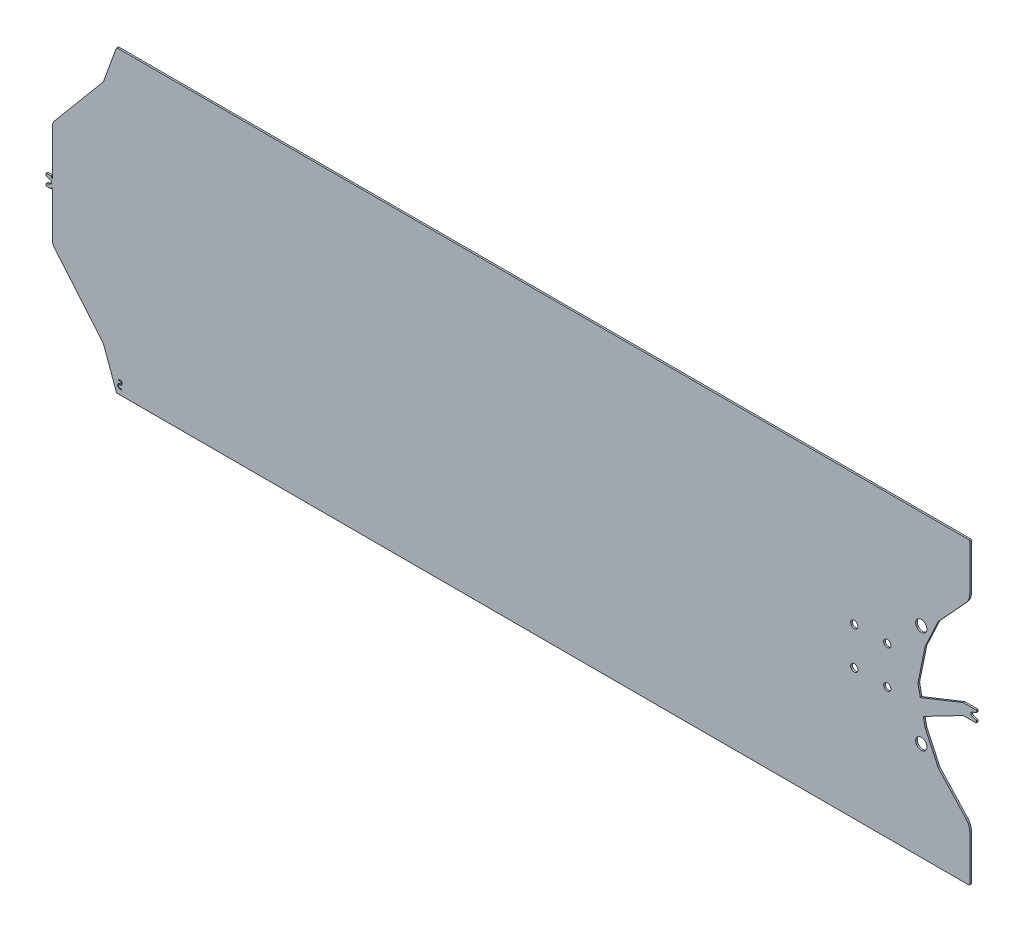
from build123d import *

# Parameters (mm, degrees)
SKETCH1_R                      = 17.125
SKETCH1_R_2                    = 11
BASE_EXTRUDE_DEPTH             = 5
SK_RET_5_TAL_DEPTH             = 2837.452108268
SKETCH2_OUTSIDE_W              = 3414.424
SKETCH2_OUTSIDE_H              = 1500.924
BORTSK_RING_AF_BUKKESTOP_DEPTH = 5
BUKKESTOP_FARINA_DEPTH         = 5


with BuildPart() as part:
    # Sketch1 → Base-Extrude (new body)
    with BuildSketch(Plane.XY):
        with BuildLine():
            Line((0, 450.25), (0, 311.805149274))
            ThreePointArc((0, 311.805149274), (-2.719685229, 297.307627743), (-10.508906528, 284.781540969))
            Line((-10.508906528, 284.781540969), (-94.490164622, 193.132080081))
            ThreePointArc((-94.490164622, 193.132080081), (-95.432087377, 191.931880335), (-96.180469124, 190.602360622))
            Line((-96.180469124, 190.602360622), (-134.781265361, 107.822685955))
            ThreePointArc((-134.781265361, 107.822685955), (-135.215178753, 106.728141402), (-135.517434537, 105.590182681))
            Line((-135.517434537, 105.590182681), (-154.559858359, 11.993679344))
            ThreePointArc((-154.559858359, 11.993679344), (-152.504537753, 3.672946714), (-144.760611313, 0))
            Line((-144.760611313, 0), (17, 0))
            ThreePointArc((17, 0), (19.121320344, -0.878679656), (20, -3))
            Line((20, -3), (20, -17.334351162))
            ThreePointArc((20, -17.334351162), (19.242605724, -19.327017609), (17.352853621, -20.313527948))
            Line((17.352853621, -20.313527948), (-148.861908023, -40))
            Line((-148.861908023, -40), (-135.517434537, -105.590182681))
            ThreePointArc((-135.517434537, -105.590182681), (-135.215178753, -106.728141402), (-134.781265361, -107.822685955))
            Line((-134.781265361, -107.822685955), (-96.180469124, -190.602360622))
            ThreePointArc((-96.180469124, -190.602360622), (-95.432087377, -191.931880335), (-94.490164622, -193.132080081))
            Line((-94.490164622, -193.132080081), (-10.508906528, -284.781540969))
            ThreePointArc((-10.508906528, -284.781540969), (-2.719685229, -297.307627743), (0, -311.805149274))
            Line((0, -311.805149274), (0, -450.25))
            ThreePointArc((0, -450.25), (-0.878679656, -452.371320344), (-3, -453.25))
            Line((-3, -453.25), (-2584.097644203, -453.25))
            ThreePointArc((-2584.097644203, -453.25), (-2585.818373512, -452.707456133), (-2586.916722065, -451.27606043))
            Line((-2586.916722065, -451.27606043), (-2625.631918795, -344.906931626))
            ThreePointArc((-2625.631918795, -344.906931626), (-2626.368590965, -343.327133059), (-2627.368400571, -341.899256963))
            Line((-2627.368400571, -341.899256963), (-2775.320888862, -165.576347508))
            ThreePointArc((-2775.320888862, -165.576347508), (-2778.793852416, -159.560998181), (-2780, -152.720595315))
            Line((-2780, -152.720595315), (-2780, -22.342329219))
            ThreePointArc((-2780, -22.342329219), (-2780.635383686, -20.496092591), (-2782.272393125, -19.431901719))
            Line((-2782.272393125, -19.431901719), (-2797.727606875, -15.568098281))
            ThreePointArc((-2797.727606875, -15.568098281), (-2799.364616314, -14.503907409), (-2800, -12.657670781))
            Line((-2800, -12.657670781), (-2800, -3))
            ThreePointArc((-2800, -3), (-2799.121320344, -0.878679656), (-2797, 0))
            Line((-2797, 0), (-2792.062257748, 0))
            ThreePointArc((-2792.062257748, 0), (-2789.427026365, -0.750817072), (-2787.583225666, -2.777777778))
            ThreePointArc((-2787.583225666, -2.777777778), (-2783.087011135, -4.894412835), (-2780, -1))
            Line((-2780, -1), (-2780, 0))
            Line((-2780, 0), (-2780, 152.720595315))
            ThreePointArc((-2780, 152.720595315), (-2778.793852416, 159.560998181), (-2775.320888862, 165.576347508))
            Line((-2775.320888862, 165.576347508), (-2627.368400571, 341.899256963))
            ThreePointArc((-2627.368400571, 341.899256963), (-2626.368590965, 343.327133059), (-2625.631918795, 344.906931626))
            Line((-2625.631918795, 344.906931626), (-2586.916722065, 451.27606043))
            ThreePointArc((-2586.916722065, 451.27606043), (-2585.818373512, 452.707456133), (-2584.097644203, 453.25))
            Line((-2584.097644203, 453.25), (-3, 453.25))
            ThreePointArc((-3, 453.25), (-0.878679656, 452.371320344), (0, 450.25))
        make_face()
        with Locations((-147, 154.75)):
            Circle(SKETCH1_R, mode=Mode.SUBTRACT)
        with Locations(Location((-147, -154.75, 0), (0, 0, 180))):
            Circle(SKETCH1_R, mode=Mode.SUBTRACT)
        with Locations((-250, 57)):
            Circle(SKETCH1_R_2, mode=Mode.SUBTRACT)
        with Locations((-350, 57)):
            Circle(SKETCH1_R_2, mode=Mode.SUBTRACT)
        with Locations(Location((-250, -57, 0), (0, 0, 180))):
            Circle(SKETCH1_R_2, mode=Mode.SUBTRACT)
        with Locations(Location((-350, -57, 0), (0, 0, 180))):
            Circle(SKETCH1_R_2, mode=Mode.SUBTRACT)
    extrude(amount=BASE_EXTRUDE_DEPTH)

    # Sketch5 → Skåret 5 tal (cut, through all)
    with BuildSketch(Plane.XY.offset(5)):
        with BuildLine():
            Line((-2579.25, -414.25), (-2573, -414.25))
            ThreePointArc((-2573, -414.25), (-2570.878679656, -415.128679656), (-2570, -417.25))
            Line((-2570, -417.25), (-2570, -423.25))
            ThreePointArc((-2570, -423.25), (-2570.878679656, -425.371320344), (-2573, -426.25))
            Line((-2573, -426.25), (-2575.5, -426.25))
            ThreePointArc((-2575.5, -426.25), (-2580.25, -431), (-2575.5, -435.75))
            Line((-2575.5, -435.75), (-2571, -435.75))
            ThreePointArc((-2571, -435.75), (-2570.292893219, -436.042893219), (-2570, -436.75))
            Line((-2570, -436.75), (-2570, -437.25))
            ThreePointArc((-2570, -437.25), (-2570.292893219, -437.957106781), (-2571, -438.25))
            Line((-2571, -438.25), (-2575.5, -438.25))
            ThreePointArc((-2575.5, -438.25), (-2582.75, -431), (-2575.5, -423.75))
            Line((-2575.5, -423.75), (-2573.5, -423.75))
            ThreePointArc((-2573.5, -423.75), (-2572.792893219, -423.457106781), (-2572.5, -422.75))
            Line((-2572.5, -422.75), (-2572.5, -417.75))
            ThreePointArc((-2572.5, -417.75), (-2572.792893219, -417.042893219), (-2573.5, -416.75))
            Line((-2573.5, -416.75), (-2579.25, -416.75))
            ThreePointArc((-2579.25, -416.75), (-2579.957106781, -416.457106781), (-2580.25, -415.75))
            Line((-2580.25, -415.75), (-2580.25, -415.25))
            ThreePointArc((-2580.25, -415.25), (-2579.957106781, -414.542893219), (-2579.25, -414.25))
        make_face()
    extrude(amount=-SK_RET_5_TAL_DEPTH, mode=Mode.SUBTRACT)

    # Sketch2 outside → Bortskæring af bukkestop (cut)
    with BuildSketch(Plane.XY.offset(5)):
        with Locations((-1390, 0)):
            Rectangle(SKETCH2_OUTSIDE_W, SKETCH2_OUTSIDE_H)
        with BuildLine():
            Line((0, -453.25), (-2780, -453.25))
            Line((-2780, -453.25), (-2780, 453.25))
            Line((-2780, 453.25), (0, 453.25))
            Line((0, 453.25), (0, 58.791931013))
            Line((0, 58.791931013), (-145.038646448, 58.791931013))
            Line((-145.038646448, 58.791931013), (-156.594381353, 1.993679344))
            ThreePointArc((-156.594381353, 1.993679344), (-156.795134307, 0), (-156.594381353, -1.993679344))
            Line((-156.594381353, -1.993679344), (-145.038646448, -58.791931013))
            Line((-145.038646448, -58.791931013), (0, -58.791931013))
            Line((0, -58.791931013), (0, -453.25))
        make_face(mode=Mode.SUBTRACT)
    extrude(amount=-BORTSK_RING_AF_BUKKESTOP_DEPTH, mode=Mode.SUBTRACT)

    # Sketch6 → Bukkestop - Farina (add)
    with BuildSketch(Plane.XY.offset(5)):
        with BuildLine():
            Line((-2786.94787914, 5.638155725), (-2799.342020143, 10.149254129))
            ThreePointArc((-2799.342020143, 10.149254129), (-2799.819152044, 10.515370314), (-2800, 11.08894675))
            Line((-2800, 11.08894675), (-2800, 16))
            ThreePointArc((-2800, 16), (-2799.707106781, 16.707106781), (-2799, 17))
            Line((-2799, 17), (-2786, 17))
            ThreePointArc((-2786, 17), (-2784.585786438, 16.414213562), (-2784, 15))
            Line((-2784, 15), (-2784, 14.5))
            ThreePointArc((-2784, 14.5), (-2782, 12.5), (-2780, 14.5))
            Line((-2780, 14.5), (-2780, -14.5))
            ThreePointArc((-2780, -14.5), (-2782, -12.5), (-2784, -14.5))
            Line((-2784, -14.5), (-2784, -15))
            ThreePointArc((-2784, -15), (-2784.585786438, -16.414213562), (-2786, -17))
            Line((-2786, -17), (-2799, -17))
            ThreePointArc((-2799, -17), (-2799.707106781, -16.707106781), (-2800, -16))
            Line((-2800, -16), (-2800, -11.08894675))
            ThreePointArc((-2800, -11.08894675), (-2799.819152044, -10.515370314), (-2799.342020143, -10.149254129))
            Line((-2799.342020143, -10.149254129), (-2786.94787914, -5.638155725))
            ThreePointArc((-2786.94787914, -5.638155725), (-2783, 0), (-2786.94787914, 5.638155725))
        make_face()
        with BuildLine():
            Line((6.94787914, 5.638155725), (19.342020143, 10.149254129))
            ThreePointArc((19.342020143, 10.149254129), (19.819152044, 10.515370314), (20, 11.08894675))
            Line((20, 11.08894675), (20, 16))
            ThreePointArc((20, 16), (19.707106781, 16.707106781), (19, 17))
            Line((19, 17), (-19.424545303, 17))
            ThreePointArc((-19.424545303, 17), (-19.989696761, 16.946286447), (-20.534610691, 16.787069219))
            Line((-20.534610691, 16.787069219), (-149.930032595, -34.75))
            Line((-149.930032595, -34.75), (-140.774679121, -79.75))
            Line((-140.774679121, -79.75), (-20.650302992, -17.337873079))
            ThreePointArc((-20.650302992, -17.337873079), (-19.979067171, -17.085692127), (-19.267161546, -17))
            Line((-19.267161546, -17), (19, -17))
            ThreePointArc((19, -17), (19.707106781, -16.707106781), (20, -16))
            Line((20, -16), (20, -11.08894675))
            ThreePointArc((20, -11.08894675), (19.819152044, -10.515370314), (19.342020143, -10.149254129))
            Line((19.342020143, -10.149254129), (6.94787914, -5.638155725))
            ThreePointArc((6.94787914, -5.638155725), (3, 0), (6.94787914, 5.638155725))
        make_face()
    extrude(amount=-BUKKESTOP_FARINA_DEPTH)


solid = part.part
